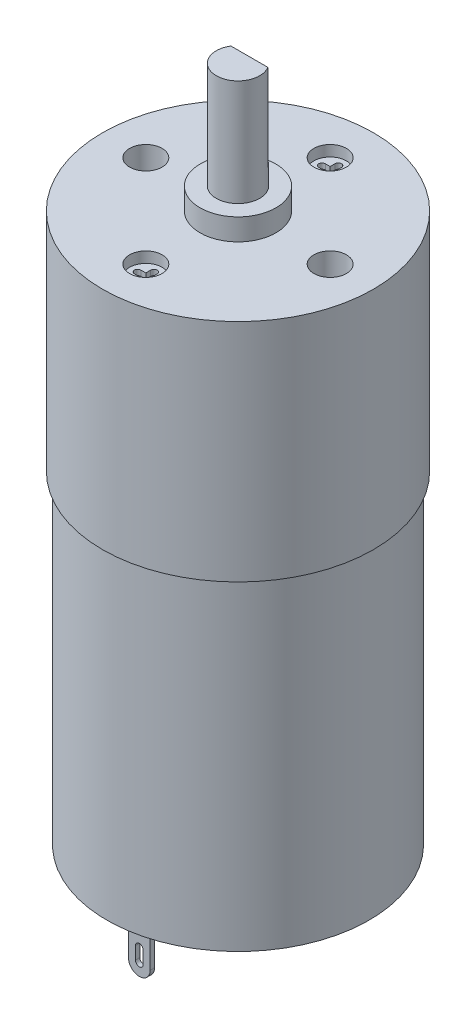
from build123d import *

# Parameters (mm, degrees)
ESBO_O1_R                = 12.5
RESSALTO_EXTRUS_O1_DEPTH = 20.8
ESBO_O2_R                = 12.1
RESSALTO_EXTRUS_O2_DEPTH = 29.8
ESBO_O3_R                = 2
RESSALTO_EXTRUS_O3_DEPTH = 11.8
CORTE_EXTRUS_O1_START    = -8.1
CORTE_EXTRUS_O1_DEPTH    = 8.1
ESBO_O5_R                = 3.5
RESSALTO_EXTRUS_O4_DEPTH = 2
ESBO_O6_R                = 1.5
CORTE_EXTRUS_O2_DEPTH    = 10
RESSALTO_EXTRUS_O5_START = 9
ESBO_O8_R                = 1.5
RESSALTO_EXTRUS_O5_DEPTH = 9
CORTE_EXTRUS_O3_DEPTH    = 0.5
ESBO_O10_R               = 4.25
RESSALTO_EXTRUS_O6_DEPTH = 2.8
ESBO_O11_W               = 2
ESBO_O11_H               = 0.4
RESSALTO_EXTRUS_O8_DEPTH = 6
FILETE1_R                = 1
CORTE_EXTRUS_O4_DEPTH    = 22


with BuildPart() as part:
    # Esboço1 → Ressalto-extrusão1 (new body)
    with BuildSketch(Plane(origin=(0, 0, 0), x_dir=(1, 0, 0), z_dir=(0, 1, 0))):
        with Locations(Location((0, 0, 0), (0, 0, 270))):
            Circle(ESBO_O1_R)
    extrude(amount=RESSALTO_EXTRUS_O1_DEPTH)

    # Esboço2 → Ressalto-extrusão2 (add)
    with BuildSketch(Plane(origin=(0, 0, 0), x_dir=(-1, 0, 0), z_dir=(0, -1, 0))):
        with Locations(Location((0, 0, 0), (0, 0, 90))):
            Circle(ESBO_O2_R)
    extrude(amount=RESSALTO_EXTRUS_O2_DEPTH)

    # Esboço3 → Ressalto-extrusão3 (add)
    with BuildSketch(Plane(origin=(0, 20.8, 0), x_dir=(1, 0, 0), z_dir=(0, 1, 0))):
        with Locations(Location((0, 0, 0), (0, 0, 270))):
            Circle(ESBO_O3_R)
    extrude(amount=RESSALTO_EXTRUS_O3_DEPTH)

    # Esboço4 → Corte-extrusão1 (cut)
    with BuildSketch(Plane(origin=(0, 32.6, 0), x_dir=(1, 0, 0), z_dir=(0, 1, 0)).offset(CORTE_EXTRUS_O1_START)):
        with BuildLine():
            Line((-1.702650866, 1.049275955), (1.702650866, 1.049275955))
            ThreePointArc((1.702650866, 1.049275955), (0, 2), (-1.702650866, 1.049275955))
        make_face()
    extrude(amount=CORTE_EXTRUS_O1_DEPTH, mode=Mode.SUBTRACT)

    # Esboço5 → Ressalto-extrusão4 (add)
    with BuildSketch(Plane(origin=(0, 20.8, 0), x_dir=(1, 0, 0), z_dir=(0, 1, 0))):
        with Locations(Location((0, 0, 0), (0, 0, 270))):
            Circle(ESBO_O5_R)
    extrude(amount=RESSALTO_EXTRUS_O4_DEPTH)

    # Esboço6 → Corte-extrusão2 (cut)
    with BuildSketch(Plane(origin=(0, 20.8, 0), x_dir=(1, 0, 0), z_dir=(0, 1, 0))):
        with Locations(Location((0, 8.5, 0), (0, 0, 270))):
            Circle(ESBO_O6_R)
        with Locations(Location((8.5, 0, 0), (0, 0, 270))):
            Circle(ESBO_O6_R)
        with Locations(Location((0, -8.5, 0), (0, 0, 270))):
            Circle(ESBO_O6_R)
        with Locations(Location((-8.5, 0, 0), (0, 0, 270))):
            Circle(ESBO_O6_R)
    extrude(amount=-CORTE_EXTRUS_O2_DEPTH, mode=Mode.SUBTRACT)

    # Esboço8 → Ressalto-extrusão5 (add)
    with BuildSketch(Plane(origin=(0, 10.8, 0), x_dir=(1, 0, 0), z_dir=(0, 1, 0)).offset(RESSALTO_EXTRUS_O5_START)):
        with Locations(Location((0, 8.5, 0), (0, 0, 270))):
            Circle(ESBO_O8_R)
        with Locations(Location((0, -8.5, 0), (0, 0, 270))):
            Circle(ESBO_O8_R)
    extrude(amount=-RESSALTO_EXTRUS_O5_DEPTH)

    # Esboço9 → Corte-extrusão3 (cut)
    with BuildSketch(Plane(origin=(0, 19.8, 0), x_dir=(1, 0, 0), z_dir=(0, 1, 0))):
        with BuildLine():
            Line((-0.3, 8.2), (-0.3, 7.75))
            ThreePointArc((-0.3, 7.75), (0, 7.45), (0.3, 7.75))
            Line((0.3, 7.75), (0.3, 8.2))
            Line((0.3, 8.2), (0.75, 8.2))
            ThreePointArc((0.75, 8.2), (1.05, 8.5), (0.75, 8.8))
            Line((0.75, 8.8), (0.3, 8.8))
            Line((0.3, 8.8), (0.3, 9.25))
            ThreePointArc((0.3, 9.25), (0, 9.55), (-0.3, 9.25))
            Line((-0.3, 9.25), (-0.3, 8.8))
            Line((-0.3, 8.8), (-0.75, 8.8))
            ThreePointArc((-0.75, 8.8), (-1.05, 8.5), (-0.75, 8.2))
            Line((-0.75, 8.2), (-0.3, 8.2))
        make_face()
        with BuildLine():
            Line((0.3, -8.2), (0.3, -7.75))
            ThreePointArc((0.3, -7.75), (0, -7.45), (-0.3, -7.75))
            Line((-0.3, -7.75), (-0.3, -8.2))
            Line((-0.3, -8.2), (-0.75, -8.2))
            ThreePointArc((-0.75, -8.2), (-1.05, -8.5), (-0.75, -8.8))
            Line((-0.75, -8.8), (-0.3, -8.8))
            Line((-0.3, -8.8), (-0.3, -9.25))
            ThreePointArc((-0.3, -9.25), (0, -9.55), (0.3, -9.25))
            Line((0.3, -9.25), (0.3, -8.8))
            Line((0.3, -8.8), (0.75, -8.8))
            ThreePointArc((0.75, -8.8), (1.05, -8.5), (0.75, -8.2))
            Line((0.75, -8.2), (0.3, -8.2))
        make_face()
    extrude(amount=-CORTE_EXTRUS_O3_DEPTH, mode=Mode.SUBTRACT)

    # Esboço10 → Ressalto-extrusão6 (add)
    with BuildSketch(Plane.XZ.offset(29.8)):
        with Locations(Location((0, 0, 0), (0, 0, 270))):
            Circle(ESBO_O10_R)
    extrude(amount=RESSALTO_EXTRUS_O6_DEPTH)

    # Esboço11 → Ressalto-extrusão8 (add)
    with BuildSketch(Plane(origin=(0, -29.8, 0), x_dir=(-1, 0, 0), z_dir=(0, -1, 0))):
        with Locations((0, 8.9)):
            Rectangle(ESBO_O11_W, ESBO_O11_H)
        with Locations((0, -8.9)):
            Rectangle(ESBO_O11_W, ESBO_O11_H)
    extrude(amount=RESSALTO_EXTRUS_O8_DEPTH)

    # Filete1
    filete1_edges = [part.edges().sort_by_distance(p)[0] for p in [
        (1, -35.8, -8.9),
        (-1, -35.8, -8.9),
        (-1, -35.8, 8.9),
        (1, -35.8, 8.9),
    ]]
    fillet(filete1_edges, radius=FILETE1_R - 0.0001)  # a hair under: the kernel refuses the full size

    # Esboço12 → Corte-extrusão4 (cut)
    with BuildSketch(Plane.XY.offset(9.1)):
        with BuildLine():
            Line((0.355764182, -33.51076438), (0.355764182, -34.668869147))
            ThreePointArc((0.355764182, -34.668869147), (0, -35.024633329), (-0.355764182, -34.668869147))
            Line((-0.355764182, -34.668869147), (-0.355764182, -33.51076438))
            ThreePointArc((-0.355764182, -33.51076438), (0, -33.155000198), (0.355764182, -33.51076438))
        make_face()
    extrude(amount=-CORTE_EXTRUS_O4_DEPTH, mode=Mode.SUBTRACT)


solid = part.part
